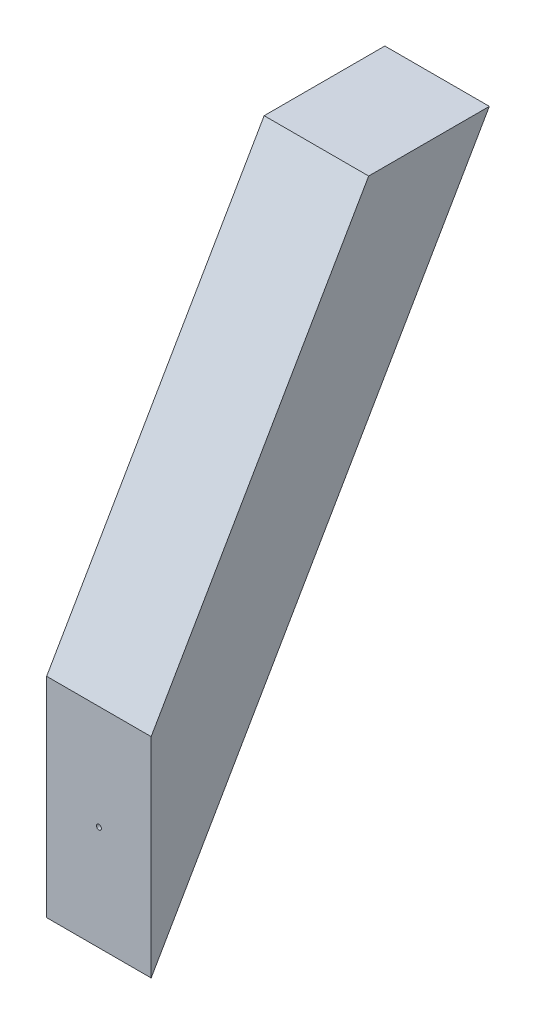
from build123d import *

# Parameters (mm, degrees)
BOSS_EXTRUDE1_DEPTH       = 12.7
F_0_80_TAPPED_HOLE1_D     = 1.19126
F_0_80_TAPPED_HOLE1_DEPTH = 10
F_0_80_TAPPED_HOLE1_TIP   = 0.357890611


with BuildPart() as part:
    # Sketch1 → Boss-Extrude1 (new, symmetric)
    with BuildSketch(Plane(origin=(0, 0, 0), x_dir=(0, 0, -1), z_dir=(1, 0, 0))):
        Polygon((0, 0), (0, 50.8), (52.861, 142.357937739), (82.190393675, 142.357937739), align=None)
    extrude(amount=BOSS_EXTRUDE1_DEPTH, both=True)

    # #0-80 Tapped Hole1
    with Locations(Plane.XY):
        with Locations((0, 25.4)):
            Hole(F_0_80_TAPPED_HOLE1_D / 2, depth=F_0_80_TAPPED_HOLE1_DEPTH)
            with Locations((0, 0, -(F_0_80_TAPPED_HOLE1_DEPTH + F_0_80_TAPPED_HOLE1_TIP / 2))):  # 118° drill point
                Cone(0, F_0_80_TAPPED_HOLE1_D / 2, F_0_80_TAPPED_HOLE1_TIP, mode=Mode.SUBTRACT)


solid = part.part
